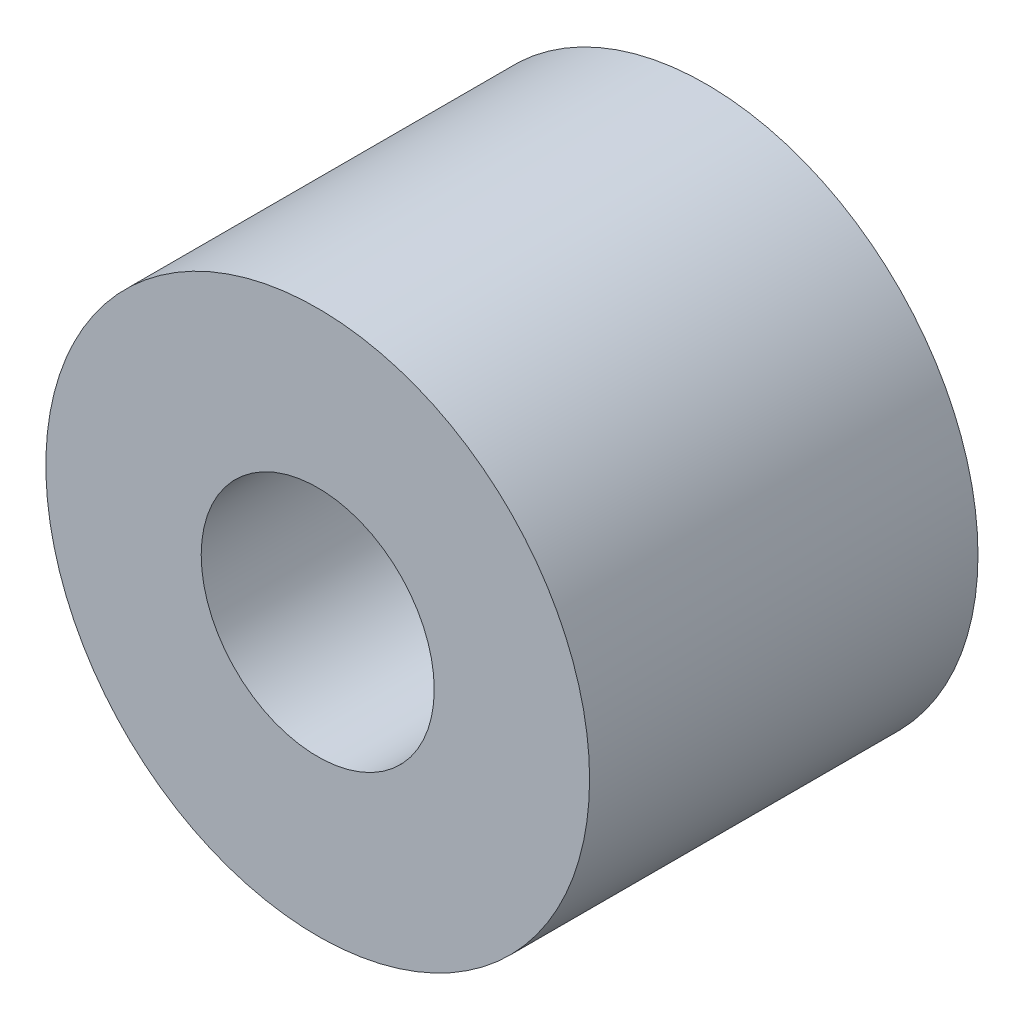
from build123d import *

# Parameters (mm, degrees)
CROQUIS8_R         = 3.5
CROQUIS8_R_2       = 1.5
EJE_SUPERIOR_DEPTH = 5


with BuildPart() as part:
    # Croquis8 → Eje superior (new body)
    with BuildSketch(Plane.XY):
        with Locations((-55.210899835, 28.817399827)):
            Circle(CROQUIS8_R)
        with Locations((-55.210899835, 28.817399827)):
            Circle(CROQUIS8_R_2, mode=Mode.SUBTRACT)
    extrude(amount=EJE_SUPERIOR_DEPTH)


solid = part.part
